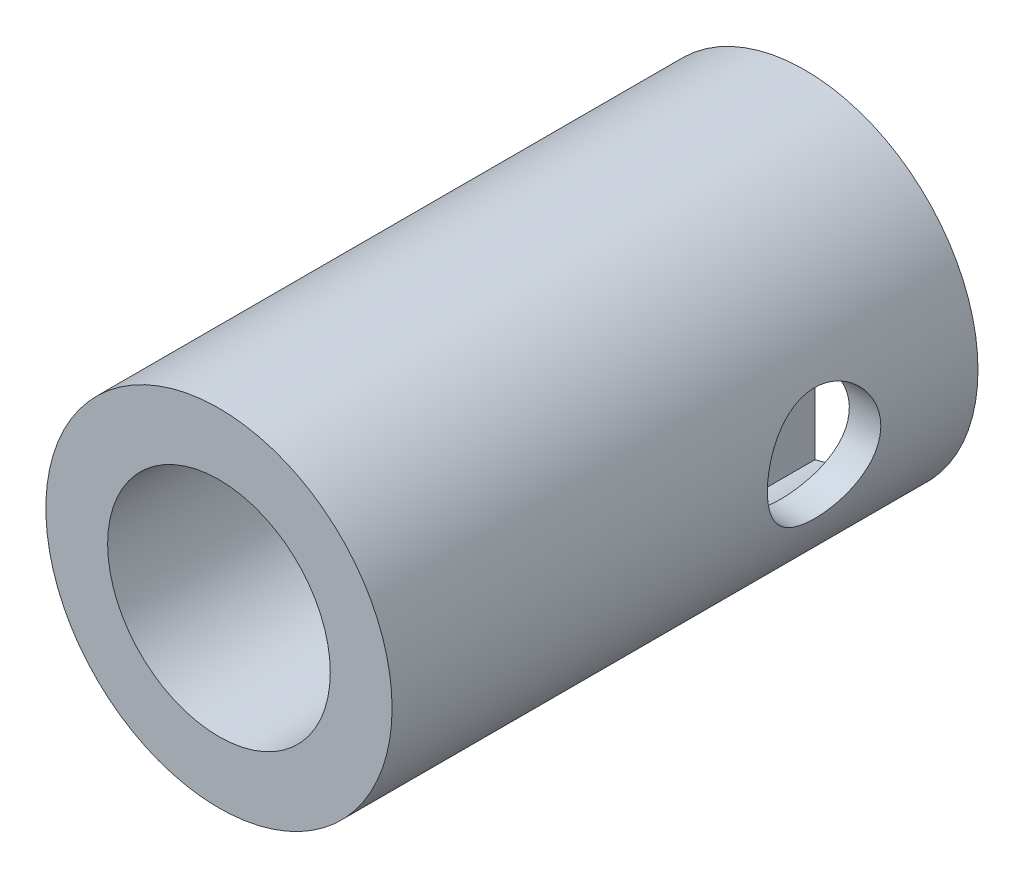
from build123d import *

# Parameters (mm, degrees)
BOSS_EXTRUDE1_DEPTH      = 6.35
BOSS_EXTRUDE1_DEPTH_BACK = 7.62
SKETCH1_R                = 4.1275
CUT_EXTRUDE1_DEPTH       = 7.874
F_2_CLEARANCE_HOLE1_D    = 2.7051
CHAMFER1_SIZE            = 0.508


with BuildPart() as part:
    # Sketch1 → Boss-Extrude1 (new, two sides: drawn at the far end of the back side and taken through both)
    with BuildSketch(Plane.XY.offset(-BOSS_EXTRUDE1_DEPTH_BACK)):
        Circle(SKETCH1_R)
    extrude(amount=BOSS_EXTRUDE1_DEPTH + BOSS_EXTRUDE1_DEPTH_BACK)

    # Sketch2 → Cut-Extrude1 (cut)
    with BuildSketch(Plane(origin=(0, 0, -7.62), x_dir=(-1, 0, 0), z_dir=(0, 0, -1))):
        with BuildLine():
            Line((-0.746, -3.293929837), (-0.746, 3.293929837))
            ThreePointArc((-0.746, 3.293929837), (-3.377349518, 0), (-0.746, -3.293929837))
        make_face()
        with BuildLine():
            Line((0.746, -3.293929837), (0.746, 3.293929837))
            ThreePointArc((0.746, 3.293929837), (3.377349518, 0), (0.746, -3.293929837))
        make_face()
    extrude(amount=-CUT_EXTRUDE1_DEPTH, mode=Mode.SUBTRACT)

    # #2 Clearance Hole1 (through all)
    with Locations(Plane.ZY.offset(4.1275)):
        with Locations((-3.95, 0)):
            Hole(F_2_CLEARANCE_HOLE1_D / 2)

    # Sketch5 → Hole1 (revolve, cut)
    with BuildSketch(Plane(origin=(0, 0, 6.35), x_dir=(0, -1, 0), z_dir=(1, 0, 0))):
        Polygon((0, 0), (0, 3.81), (2.5273, 3.81), (2.6543, 0), align=None)
    revolve(axis=Axis((0, 0, -103.65), (0, 0, 1)), mode=Mode.SUBTRACT)

    # Chamfer1
    chamfer1_edges = [part.edges().sort_by_distance(p)[0] for p in [
        (3.377349518, 0, -7.62),
        (0.746, 0, -7.62),
        (-3.377349518, 0, -7.62),
        (-0.746, 0, -7.62),
    ]]
    chamfer(chamfer1_edges, length=CHAMFER1_SIZE)


solid = part.part
